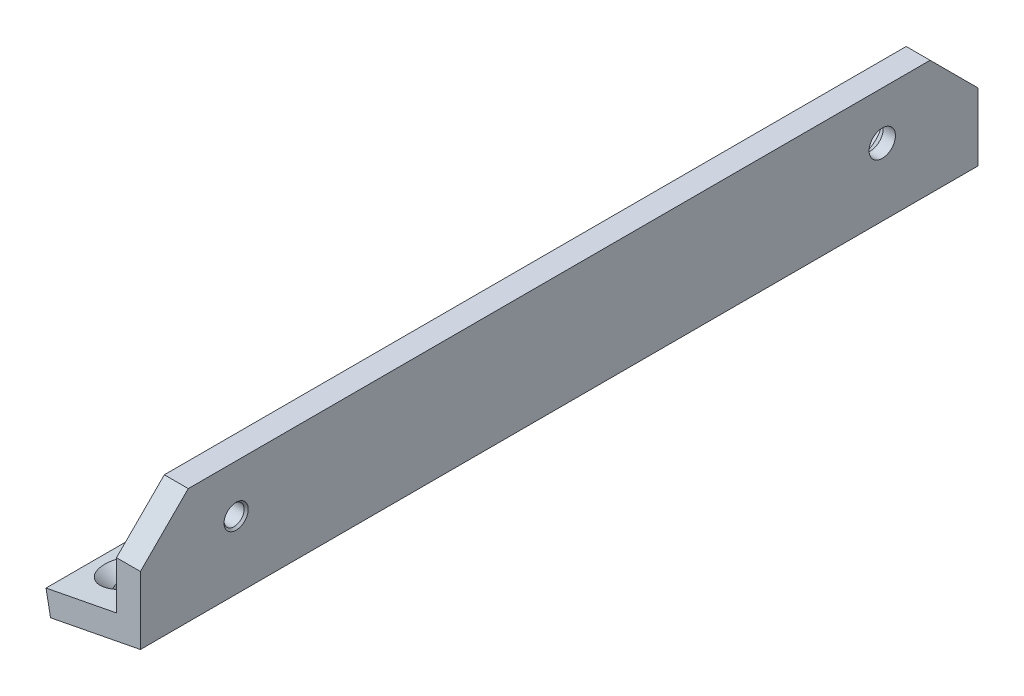
from build123d import *

# Parameters (mm, degrees)
BOSS_EXTRU_1_DEPTH                             = 175
CHANFREIN1_SIZE                                = 10
FRAISAGE_POUR_VIS_T_TE_FRAIS_E_M51_D           = 5.5
FRAISAGE_POUR_VIS_T_TE_FRAIS_E_M51_DEPTH       = 25
FRAISAGE_POUR_VIS_T_TE_FRAIS_E_M51_CSINK_D     = 10.4
FRAISAGE_POUR_VIS_T_TE_FRAIS_E_M51_CSINK_ANGLE = 90
FRAISAGE_POUR_VIS_T_TE_FRAIS_E_M51_TIP         = 1.652366702
TROU_TARAUD_M51_D                              = 4.2
TROU_TARAUD_M51_CSINK_D                        = 5.05
TROU_TARAUD_M51_CSINK_ANGLE                    = 90
FRAISAGE_POUR_VIS_T_TE_FRAIS_E_M52_D           = 5.5
FRAISAGE_POUR_VIS_T_TE_FRAIS_E_M52_CSINK_D     = 10.4
FRAISAGE_POUR_VIS_T_TE_FRAIS_E_M52_CSINK_ANGLE = 90


with BuildPart() as part:
    # Esquisse1 → Boss.-Extru.1 (new body)
    with BuildSketch(Plane.XY):
        Polygon((-10, 24.123808081), (-10, 0), (-28.774294806, -3.639490355), (-29.725854856, 1.26912793), (-15, 4.123808081), (-15, 24.123808081), align=None)
    extrude(amount=BOSS_EXTRU_1_DEPTH)

    # Chanfrein1
    chanfrein1_edges = [part.edges().sort_by_distance(p)[0] for p in [
        (-12.5, 24.123808081, 175),
        (-12.5, 24.123808081, 0),
    ]]
    chamfer(chanfrein1_edges, length=CHANFREIN1_SIZE)

    # Fraisage pour vis à tête fraisée M51
    with Locations(Plane.ZY.offset(15)):
        with Locations((20, 14.123808081)):
            CounterSinkHole(FRAISAGE_POUR_VIS_T_TE_FRAIS_E_M51_D / 2, FRAISAGE_POUR_VIS_T_TE_FRAIS_E_M51_CSINK_D / 2, depth=FRAISAGE_POUR_VIS_T_TE_FRAIS_E_M51_DEPTH, counter_sink_angle=FRAISAGE_POUR_VIS_T_TE_FRAIS_E_M51_CSINK_ANGLE)
            with Locations((0, 0, -(FRAISAGE_POUR_VIS_T_TE_FRAIS_E_M51_DEPTH + FRAISAGE_POUR_VIS_T_TE_FRAIS_E_M51_TIP / 2))):  # 118° drill point
                Cone(0, FRAISAGE_POUR_VIS_T_TE_FRAIS_E_M51_D / 2, FRAISAGE_POUR_VIS_T_TE_FRAIS_E_M51_TIP, mode=Mode.SUBTRACT)

    # Trou taraudé M51 (through all)
    with Locations(Plane(origin=(-10, 0, 0), x_dir=(0, 0, -1), z_dir=(1, 0, 0))):
        with Locations((-155, 14.123808081)):
            CounterSinkHole(TROU_TARAUD_M51_D / 2, TROU_TARAUD_M51_CSINK_D / 2, counter_sink_angle=TROU_TARAUD_M51_CSINK_ANGLE)

    # Fraisage pour vis à tête fraisée M52 (through all)
    with Locations(Plane(origin=(-1.313746662, 6.77695631, 0), x_dir=(0.9817236570645551, 0.19031201002510603, 0), z_dir=(-0.19031201002510603, 0.9817236570645551, 0))):
        with Locations((-21.441044651, -87.5), (-21.441044651, -165), (-21.441044651, -10)):
            CounterSinkHole(FRAISAGE_POUR_VIS_T_TE_FRAIS_E_M52_D / 2, FRAISAGE_POUR_VIS_T_TE_FRAIS_E_M52_CSINK_D / 2, counter_sink_angle=FRAISAGE_POUR_VIS_T_TE_FRAIS_E_M52_CSINK_ANGLE)


solid = part.part
